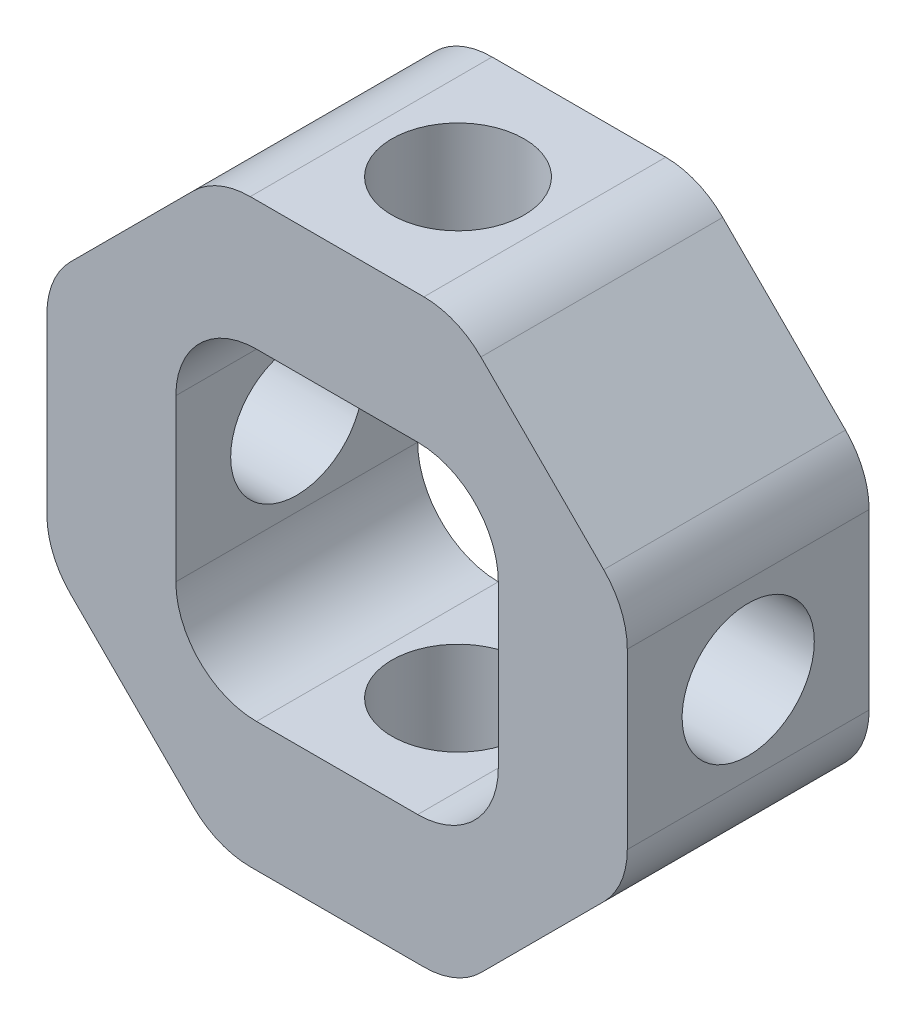
from build123d import *

# Parameters (mm, degrees)
EXTRUDE_1_DEPTH          = 7.5
CUT_EXTRUDE_1_DEPTH      = 30.546573405
CUT_EXTRUDE_1_DEPTH_BACK = 30.546573405
SKETCH_2_W               = 20
SKETCH_2_H               = 20
FILLET_1_R               = 5
FILLET_2_R               = 5
CUT_EXTRUDE_2_DEPTH      = 41.942032192
CUT_EXTRUDE_2_DEPTH_BACK = 41.942032192
SKETCH_3_R               = 4.1
CUT_EXTRUDE_3_DEPTH      = 41.942032192
CUT_EXTRUDE_3_DEPTH_BACK = 41.942032192
SKETCH_4_R               = 4.1


with BuildPart() as part:
    # ｽｹｯﾁ1 → ﾎﾞｽ - 押し出し1 (new, symmetric)
    with BuildSketch(Plane.XY):
        Polygon((7.455844123, -18), (18, -7.455844123), (18, 7.455844123), (7.455844123, 18), (-7.455844123, 18), (-18, 7.455844123), (-18, -7.455844123), (-7.455844123, -18), align=None)
    extrude(amount=EXTRUDE_1_DEPTH, both=True)

    # ｽｹｯﾁ2 → ｶｯﾄ - 押し出し1 (cut, two sides: drawn at the far end of the back side and taken through both)
    with BuildSketch(Plane.XY.offset(7.5).offset(-CUT_EXTRUDE_1_DEPTH_BACK)):
        Rectangle(SKETCH_2_W, SKETCH_2_H)
    extrude(amount=CUT_EXTRUDE_1_DEPTH + CUT_EXTRUDE_1_DEPTH_BACK, mode=Mode.SUBTRACT)

    # ﾌｨﾚｯﾄ1
    fillet_1_edges = [part.edges().sort_by_distance(p)[0] for p in [
        (10, -10, 0),
        (-10, -10, 0),
        (10, 10, 0),
        (-10, 10, 0),
    ]]
    fillet(fillet_1_edges, radius=FILLET_1_R)

    # ﾌｨﾚｯﾄ2
    fillet_2_edges = [part.edges().sort_by_distance(p)[0] for p in [
        (18, -7.455844123, 0),
        (7.455844123, -18, 0),
        (-7.455844123, -18, 0),
        (-18, -7.455844123, 0),
        (18, 7.455844123, 0),
        (7.455844123, 18, 0),
        (-18, 7.455844123, 0),
        (-7.455844123, 18, 0),
    ]]
    fillet(fillet_2_edges, radius=FILLET_2_R)

    # ｽｹｯﾁ3 → ｶｯﾄ - 押し出し2 (cut, two sides: drawn at the far end of the back side and taken through both)
    with BuildSketch(Plane.XZ.offset(18).offset(-CUT_EXTRUDE_2_DEPTH_BACK)):
        Circle(SKETCH_3_R)
    extrude(amount=CUT_EXTRUDE_2_DEPTH + CUT_EXTRUDE_2_DEPTH_BACK, mode=Mode.SUBTRACT)

    # ｽｹｯﾁ4 → ｶｯﾄ - 押し出し3 (cut, two sides: drawn at the far end of the back side and taken through both)
    with BuildSketch(Plane(origin=(18, 0, 0), x_dir=(0, 0, -1), z_dir=(1, 0, 0)).offset(-CUT_EXTRUDE_3_DEPTH_BACK)):
        Circle(SKETCH_4_R)
    extrude(amount=CUT_EXTRUDE_3_DEPTH + CUT_EXTRUDE_3_DEPTH_BACK, mode=Mode.SUBTRACT)


solid = part.part
